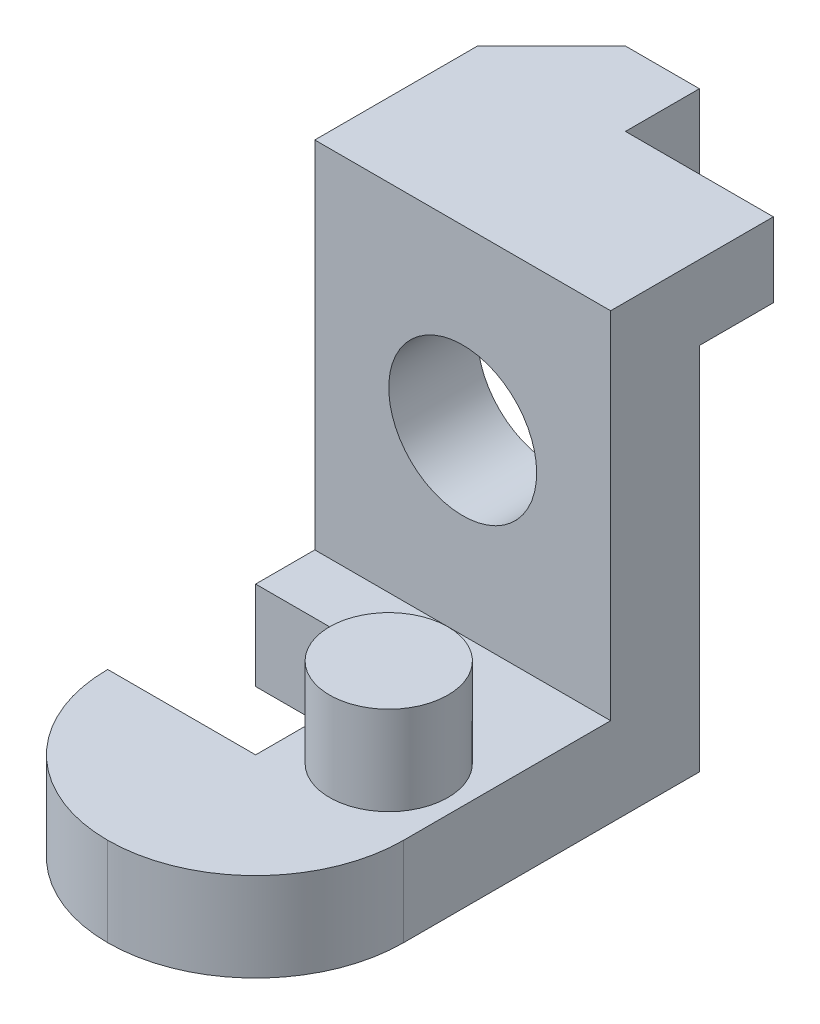
from build123d import *

# Parameters (mm, degrees)
SKETCH1_W               = 25.4
SKETCH1_H               = 50.8
BOSS_EXTRUDE1_DEPTH     = 38.1
SKETCH2_W               = 25.4
SKETCH2_H               = 30.48
CUT_EXTRUDE1_DEPTH      = 30.48
CUT_EXTRUDE2_DEPTH      = 10.668
CUT_EXTRUDE2_DEPTH_BACK = 32.258
SKETCH3_W               = 12.7
SKETCH3_H               = 31.706835607
SKETCH4_W               = 12.7
SKETCH4_H               = 6.35
CUT_EXTRUDE3_DEPTH      = 32.258
CHAMFER1_SIZE           = 6.35
FILLET1_R               = 12.7
FILLET2_R               = 12.7
SKETCH8_R               = 5.08
BOSS_EXTRUDE3_DEPTH     = 7.62
SKETCH9_R               = 6.35
CUT_EXTRUDE6_DEPTH      = 7.62
SKETCH10_W              = 12.7
SKETCH10_H              = 12.7
CUT_EXTRUDE7_DEPTH      = 7.62


with BuildPart() as part:
    # Sketch1 → Boss-Extrude1 (new body)
    with BuildSketch(Plane(origin=(0, 0, 0), x_dir=(1, 0, 0), z_dir=(0, 1, 0))):
        with Locations((12.7, 25.4)):
            Rectangle(SKETCH1_W, SKETCH1_H)
    extrude(amount=BOSS_EXTRUDE1_DEPTH)

    # Sketch2 → Cut-Extrude1 (cut)
    with BuildSketch(Plane(origin=(0, 38.1, 0), x_dir=(1, 0, 0), z_dir=(0, 1, 0))):
        with Locations((12.7, 15.24)):
            Rectangle(SKETCH2_W, SKETCH2_H)
    extrude(amount=-CUT_EXTRUDE1_DEPTH, mode=Mode.SUBTRACT)

    # Sketch3 → Cut-Extrude2 (cut, two sides: drawn at the far end of the back side and taken through both)
    with BuildSketch(Plane.ZY.offset(-CUT_EXTRUDE2_DEPTH_BACK)):
        with Locations((-44.45, 15.853417804)):
            Rectangle(SKETCH3_W, SKETCH3_H)
    extrude(amount=CUT_EXTRUDE2_DEPTH + CUT_EXTRUDE2_DEPTH_BACK, mode=Mode.SUBTRACT)

    # Sketch4 → Cut-Extrude3 (cut)
    with BuildSketch(Plane(origin=(0, 38.1, 0), x_dir=(1, 0, 0), z_dir=(0, 1, 0))):
        with Locations((19.05, 47.625)):
            Rectangle(SKETCH4_W, SKETCH4_H)
    extrude(amount=-CUT_EXTRUDE3_DEPTH, mode=Mode.SUBTRACT)

    # Chamfer1
    chamfer1_edges = [part.edges().sort_by_distance(p)[0] for p in [
        (0, 34.903417804, -50.8),
    ]]
    chamfer(chamfer1_edges, length=CHAMFER1_SIZE)

    # Fillet1
    fillet1_edges = [part.edges().sort_by_distance(p)[0] for p in [
        (25.4, 3.81, 0),
    ]]
    fillet(fillet1_edges, radius=FILLET1_R)

    # Fillet2
    fillet2_edges = [part.edges().sort_by_distance(p)[0] for p in [
        (0, 3.81, 0),
    ]]
    fillet(fillet2_edges, radius=FILLET2_R - 0.0001)  # a hair under: the kernel refuses the full size

    # Sketch8 → Boss-Extrude3 (add)
    with BuildSketch(Plane(origin=(0, 7.62, 0), x_dir=(1, 0, 0), z_dir=(0, 1, 0))):
        with Locations(Location((19.05, 17.78, 0), (0, 0, 90))):
            Circle(SKETCH8_R)
    extrude(amount=BOSS_EXTRUDE3_DEPTH)

    # Sketch9 → Cut-Extrude6 (cut)
    with BuildSketch(Plane.XY.offset(-30.48)):
        with Locations((12.7, 22.86)):
            Circle(SKETCH9_R)
    extrude(amount=-CUT_EXTRUDE6_DEPTH, mode=Mode.SUBTRACT)

    # Sketch10 → Cut-Extrude7 (cut)
    with BuildSketch(Plane(origin=(0, 7.62, 0), x_dir=(1, 0, 0), z_dir=(0, 1, 0))):
        with Locations((6.35, 19.05)):
            Rectangle(SKETCH10_W, SKETCH10_H)
    extrude(amount=-CUT_EXTRUDE7_DEPTH, mode=Mode.SUBTRACT)


solid = part.part
